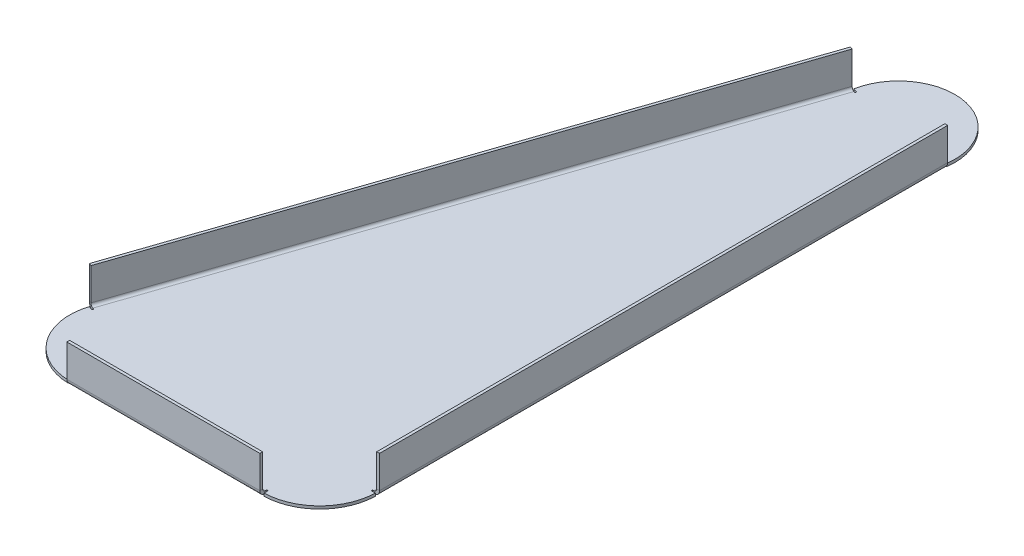
from build123d import *

# Parameters (mm, degrees)
BASE_FLANGE1_DEPTH            = 0.7366
EDGE_FLANGE1_STRIP_W          = 4.4196
EDGE_FLANGE1_STRIP_H          = 0.7366
EDGE_FLANGE1_STRIP_CUT_DEPTH  = 150
EDGE_FLANGE1_RELIEF_W         = 4.7879
EDGE_FLANGE1_RELIEF_H         = 0.3683
EDGE_FLANGE1_RELIEF_CUT_DEPTH = 0.7366
EDGE_FLANGE1_DEPTH            = 150
EDGE_FLANGE2_STRIP_W          = 4.4196
EDGE_FLANGE2_STRIP_H          = 0.7366
EDGE_FLANGE2_STRIP_CUT_DEPTH  = 50.953389831
EDGE_FLANGE2_RELIEF_W         = 4.7879
EDGE_FLANGE2_RELIEF_H         = 0.3683
EDGE_FLANGE2_RELIEF_CUT_DEPTH = 0.7366
EDGE_FLANGE2_DEPTH            = 50.953389831
EDGE_FLANGE3_STRIP_W          = 4.4196
EDGE_FLANGE3_STRIP_H          = 0.7366
EDGE_FLANGE3_STRIP_CUT_DEPTH  = 158.417953324
EDGE_FLANGE3_RELIEF_W         = 4.7879
EDGE_FLANGE3_RELIEF_H         = 0.3683
EDGE_FLANGE3_RELIEF_CUT_DEPTH = 0.7366
EDGE_FLANGE3_DEPTH            = 158.417953324


# Sheet-metal steps are written as plain solids
with BuildPart() as part:
    # Sketch1 → Base-Flange1 (new body)
    with BuildSketch(Plane(origin=(0, 0, 0), x_dir=(1, 0, 0), z_dir=(0, 1, 0))):
        with BuildLine():
            Line((40.54139599, 75), (40.54139599, -75))
            ThreePointArc((40.54139599, -75), (36.129047202, -85.652352287), (25.476694915, -90.064701075))
            Line((25.476694915, -90.064701075), (-25.476694915, -90.064701075))
            ThreePointArc((-25.476694915, -90.064701075), (-37.722911645, -83.773562235), (-39.740893599, -70.154604826))
            Line((-39.740893599, -70.154604826), (11.212496231, 79.845395174))
            ThreePointArc((11.212496231, 79.845395174), (28.299643698, 92.087147467), (40.54139599, 75))
        make_face()
    extrude(amount=-BASE_FLANGE1_DEPTH)

    # Edge-Flange1 strip (across the edge) → Edge-Flange1 strip cut (cut)
    with BuildSketch(Plane(origin=(40.54139599, 0, 75), x_dir=(-1, 0, 0), z_dir=(0, 0, -1))):
        with Locations((-1.4732, -0.3683)):
            Rectangle(EDGE_FLANGE1_STRIP_W, EDGE_FLANGE1_STRIP_H)
    extrude(amount=EDGE_FLANGE1_STRIP_CUT_DEPTH, mode=Mode.SUBTRACT)

    # Edge-Flange1 relief (on the sheet) → Edge-Flange1 relief cut (cut)
    with BuildSketch(Plane(origin=(39.80479599, 0, 75), x_dir=(-1, 0, 0), z_dir=(0, 1, 0))):
        with Locations((-2.02565, 0.18415)):
            Rectangle(EDGE_FLANGE1_RELIEF_W, EDGE_FLANGE1_RELIEF_H)
        with Locations((-2.02565, -150.18415)):
            Rectangle(EDGE_FLANGE1_RELIEF_W, EDGE_FLANGE1_RELIEF_H)
    extrude(amount=-EDGE_FLANGE1_RELIEF_CUT_DEPTH, mode=Mode.SUBTRACT)

    # Edge-Flange1 section (across the edge) → Edge-Flange1 (add)
    with BuildSketch(Plane(origin=(40.54139599, 0, 75), x_dir=(-1, 0, 0), z_dir=(0, 0, -1))):
        with BuildLine():
            Line((-0.7366, 0.7366), (-0.7366, 9.2634))
            Line((-0.7366, 9.2634), (0, 9.2634))
            Line((0, 9.2634), (0, 0.7366))
            ThreePointArc((0, 0.7366), (0.215745145, 0.215745145), (0.7366, 0))
            Line((0.7366, 0), (0.7366, -0.7366))
            ThreePointArc((0.7366, -0.7366), (-0.30510971, -0.30510971), (-0.7366, 0.7366))
        make_face()
    extrude(amount=EDGE_FLANGE1_DEPTH)

    # Edge-Flange2 strip (across the edge) → Edge-Flange2 strip cut (cut)
    with BuildSketch(Plane(origin=(-25.476694915, 0, 90.064701075), x_dir=(0, 0, -1), z_dir=(1, 0, 0))):
        with Locations((-1.4732, -0.3683)):
            Rectangle(EDGE_FLANGE2_STRIP_W, EDGE_FLANGE2_STRIP_H)
    extrude(amount=EDGE_FLANGE2_STRIP_CUT_DEPTH, mode=Mode.SUBTRACT)

    # Edge-Flange2 relief (on the sheet) → Edge-Flange2 relief cut (cut)
    with BuildSketch(Plane(origin=(-25.476694915, 0, 89.328101075), x_dir=(0, 0, -1), z_dir=(0, 1, 0))):
        with Locations((-2.02565, 0.18415)):
            Rectangle(EDGE_FLANGE2_RELIEF_W, EDGE_FLANGE2_RELIEF_H)
        with Locations((-2.02565, -51.137539831)):
            Rectangle(EDGE_FLANGE2_RELIEF_W, EDGE_FLANGE2_RELIEF_H)
    extrude(amount=-EDGE_FLANGE2_RELIEF_CUT_DEPTH, mode=Mode.SUBTRACT)

    # Edge-Flange2 section (across the edge) → Edge-Flange2 (add)
    with BuildSketch(Plane(origin=(-25.476694915, 0, 90.064701075), x_dir=(0, 0, -1), z_dir=(1, 0, 0))):
        with BuildLine():
            Line((-0.7366, 0.7366), (-0.7366, 9.2634))
            Line((-0.7366, 9.2634), (0, 9.2634))
            Line((0, 9.2634), (0, 0.7366))
            ThreePointArc((0, 0.7366), (0.215745145, 0.215745145), (0.7366, 0))
            Line((0.7366, 0), (0.7366, -0.7366))
            ThreePointArc((0.7366, -0.7366), (-0.30510971, -0.30510971), (-0.7366, 0.7366))
        make_face()
    extrude(amount=EDGE_FLANGE2_DEPTH)

    # Edge-Flange3 strip (across the edge) → Edge-Flange3 strip cut (cut)
    with BuildSketch(Plane(origin=(11.212496231, 0, -79.845395174), x_dir=(0.9468623779885023, 3.4914813388431334e-15, 0.3216389857432692), z_dir=(-0.3216389857432692, 0, 0.9468623779885023))):
        with Locations((-1.4732, -0.3683)):
            Rectangle(EDGE_FLANGE3_STRIP_W, EDGE_FLANGE3_STRIP_H)
    extrude(amount=EDGE_FLANGE3_STRIP_CUT_DEPTH, mode=Mode.SUBTRACT)

    # Edge-Flange3 relief (on the sheet) → Edge-Flange3 relief cut (cut)
    with BuildSketch(Plane(origin=(11.909955059, 0, -79.608475897), x_dir=(0.9468623779885023, 6.982962677686267e-15, 0.3216389857432692), z_dir=(0, 1, 0))):
        with Locations((-2.02565, 0.18415)):
            Rectangle(EDGE_FLANGE3_RELIEF_W, EDGE_FLANGE3_RELIEF_H)
        with Locations((-2.02565, -158.602103324)):
            Rectangle(EDGE_FLANGE3_RELIEF_W, EDGE_FLANGE3_RELIEF_H)
    extrude(amount=-EDGE_FLANGE3_RELIEF_CUT_DEPTH, mode=Mode.SUBTRACT)

    # Edge-Flange3 section (across the edge) → Edge-Flange3 (add)
    with BuildSketch(Plane(origin=(11.212496231, 0, -79.845395174), x_dir=(0.9468623779885023, 3.4914813388431334e-15, 0.3216389857432692), z_dir=(-0.3216389857432692, 0, 0.9468623779885023))):
        with BuildLine():
            Line((-0.7366, 0.7366), (-0.7366, 9.2634))
            Line((-0.7366, 9.2634), (0, 9.2634))
            Line((0, 9.2634), (0, 0.7366))
            ThreePointArc((0, 0.7366), (0.215745145, 0.215745145), (0.7366, 0))
            Line((0.7366, 0), (0.7366, -0.7366))
            ThreePointArc((0.7366, -0.7366), (-0.30510971, -0.30510971), (-0.7366, 0.7366))
        make_face()
    extrude(amount=EDGE_FLANGE3_DEPTH)


solid = part.part
